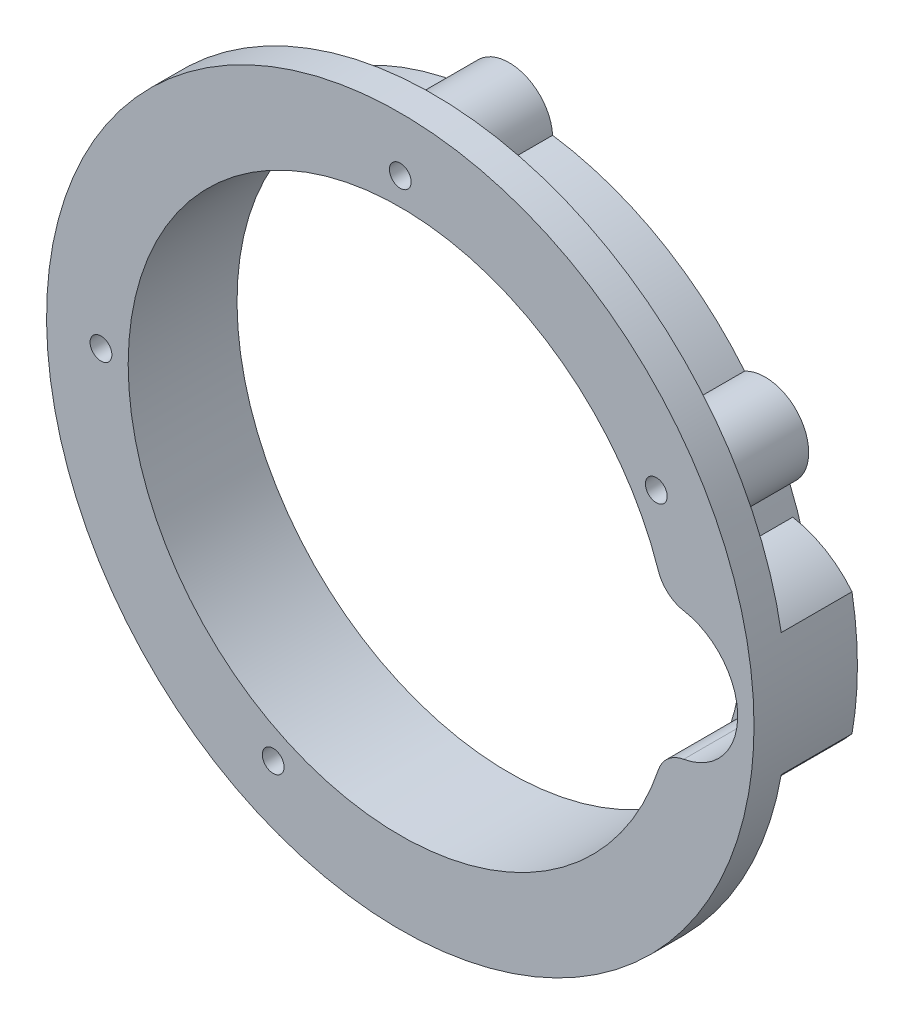
from build123d import *

# Parameters (mm, degrees)
SKETCH1_R                = 32.5
SKETCH1_R_2              = 25
SKETCH1_R_3              = 1
RING_BODY_DEPTH          = 10
SKETCH2_R                = 6
NUB_CUT_DEPTH            = 6.5
NUB_CUT_FILLETS_3MM_R    = 3
WEIGHT_REDUCTION_DEPTH   = 7
WEIGHT_REDUCTION_2_DEPTH = 0.5


# Read off the part's stored shape, not the designer's step: Weight reduction
with BuildPart() as part:
    # Sketch1 → Ring body (new body)
    with BuildSketch(Plane.XY):
        Circle(SKETCH1_R)
        Circle(SKETCH1_R_2, mode=Mode.SUBTRACT)
        with Locations((0, 27.5)):
            Circle(SKETCH1_R_3, mode=Mode.SUBTRACT)
        with Locations((23.5226917, 14.245454545)):
            Circle(SKETCH1_R_3, mode=Mode.SUBTRACT)
        with Locations((-27.5, 0)):
            Circle(SKETCH1_R_3, mode=Mode.SUBTRACT)
        with Locations((-11.677272727, -24.897616385)):
            Circle(SKETCH1_R_3, mode=Mode.SUBTRACT)
    extrude(amount=RING_BODY_DEPTH)

    # Sketch2 → Nub cut (cut)
    with BuildSketch(Plane.XY.offset(10)):
        with Locations((25, 0)):
            Circle(SKETCH2_R)
    extrude(amount=-NUB_CUT_DEPTH, mode=Mode.SUBTRACT)

    # Nub cut fillets 3mm
    nub_cut_fillets_3mm_edges = [part.edges().sort_by_distance(p)[0] for p in [
        (24.28, 5.95664335, 6.75),
        (24.28, -5.95664335, 6.75),
    ]]
    fillet(nub_cut_fillets_3mm_edges, radius=NUB_CUT_FILLETS_3MM_R)

    # Weight reduction outline → Weight reduction (cut)
    with BuildSketch(Plane.XY):
        with BuildLine():
            ThreePointArc((32.005, -5.650661466), (29.573928418, -7.751075978), (26.56, -8.86376895))
            ThreePointArc((26.56, -8.86376895), (12.846329016, -24.879144495), (-8.151686125, -26.787124021))
            ThreePointArc((-8.151686125, -26.787124021), (-13.375785124, -28.519087859), (-15.384291336, -23.394947747))
            ThreePointArc((-15.384291336, -23.394947747), (-23.631635891, -15.018181818), (-27.713636364, -3.994290864))
            ThreePointArc((-27.713636364, -3.994290864), (-31.5, 0), (-27.713636364, 3.994290864))
            ThreePointArc((-27.713636364, 3.994290864), (-19.798989873, 19.798989873), (-3.994290864, 27.713636364))
            ThreePointArc((-3.994290864, 27.713636364), (0, 31.5), (3.994290864, 27.713636364))
            ThreePointArc((3.994290864, 27.713636364), (13.745454545, 24.393902503), (21.636321277, 17.772720715))
            ThreePointArc((21.636321277, 17.772720715), (26.944174129, 16.317520661), (25.774538654, 10.939522711))
            ThreePointArc((25.774538654, 10.939522711), (26.187843982, 9.909431242), (26.56, 8.86376895))
            ThreePointArc((26.56, 8.86376895), (29.573928418, 7.751075978), (32.005, 5.650661466))
            ThreePointArc((32.005, 5.650661466), (-32.5, 0), (32.005, -5.650661466))
        make_face()
    extrude(amount=WEIGHT_REDUCTION_DEPTH, mode=Mode.SUBTRACT)

    # Weight reduction 2 outline → Weight reduction 2 (cut)
    with BuildSketch(Plane.XY):
        with BuildLine():
            ThreePointArc((26.56, 8.86376895), (28, 0), (26.56, -8.86376895))
            ThreePointArc((26.56, -8.86376895), (29.573928418, -7.751075978), (32.005, -5.650661466))
            ThreePointArc((32.005, -5.650661466), (32.5, 0), (32.005, 5.650661466))
            ThreePointArc((32.005, 5.650661466), (29.573928418, 7.751075978), (26.56, 8.86376895))
        make_face()
    extrude(amount=WEIGHT_REDUCTION_2_DEPTH, mode=Mode.SUBTRACT)


solid = part.part
